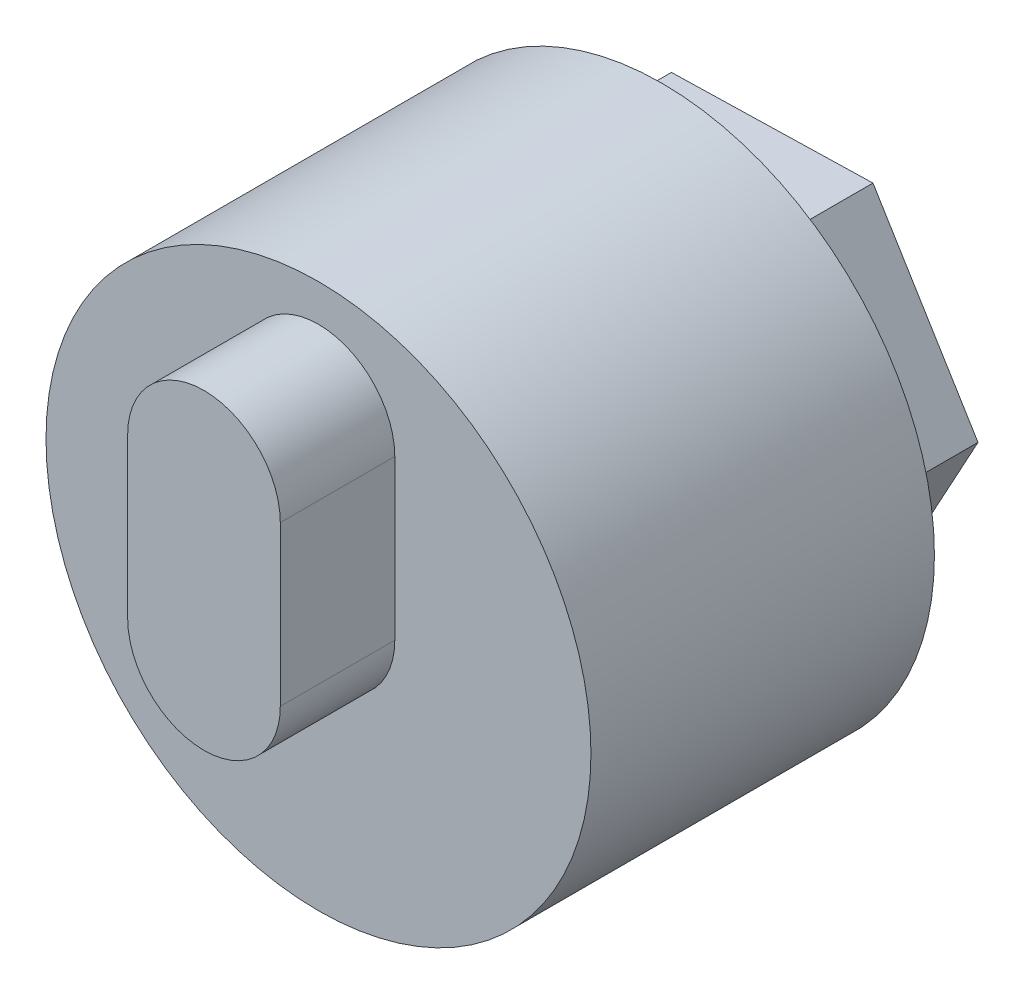
from build123d import *

# Parameters (mm, degrees)
SKETCH_1_R      = 23.797606223
EXTRUDE_1_DEPTH = 30
EXTRUDE_2_DEPTH = 10
EXTRUDE_3_DEPTH = 10


with BuildPart() as part:
    # Эскиз1 → Бобышка-Вытянуть1 (new body)
    with BuildSketch(Plane.XY):
        Circle(SKETCH_1_R)
    extrude(amount=EXTRUDE_1_DEPTH)

    # Эскиз2 → Бобышка-Вытянуть2 (add)
    with BuildSketch(Plane(origin=(0, 0, 0), x_dir=(-1, 0, 0), z_dir=(0, 0, -1))):
        Polygon((8.428591824, -15.45917893), (17.602337587, -0.430214828), (9.173745764, 15.028964103), (-8.428591824, 15.45917893), (-17.602337587, 0.430214828), (-9.173745764, -15.028964103), align=None)
    extrude(amount=EXTRUDE_2_DEPTH)

    # Эскиз3 → Бобышка-Вытянуть3 (add)
    with BuildSketch(Plane.XY.offset(30)):
        with BuildLine():
            Line((-6.665236987, 0), (-6.665236987, 13.897876636))
            ThreePointArc((-6.665236987, 13.897876636), (0, 20.563113622), (6.665236987, 13.897876636))
            Line((6.665236987, 13.897876636), (6.665236987, 0))
            ThreePointArc((6.665236987, 0), (0, -6.665236987), (-6.665236987, 0))
        make_face()
    extrude(amount=EXTRUDE_3_DEPTH)


solid = part.part
